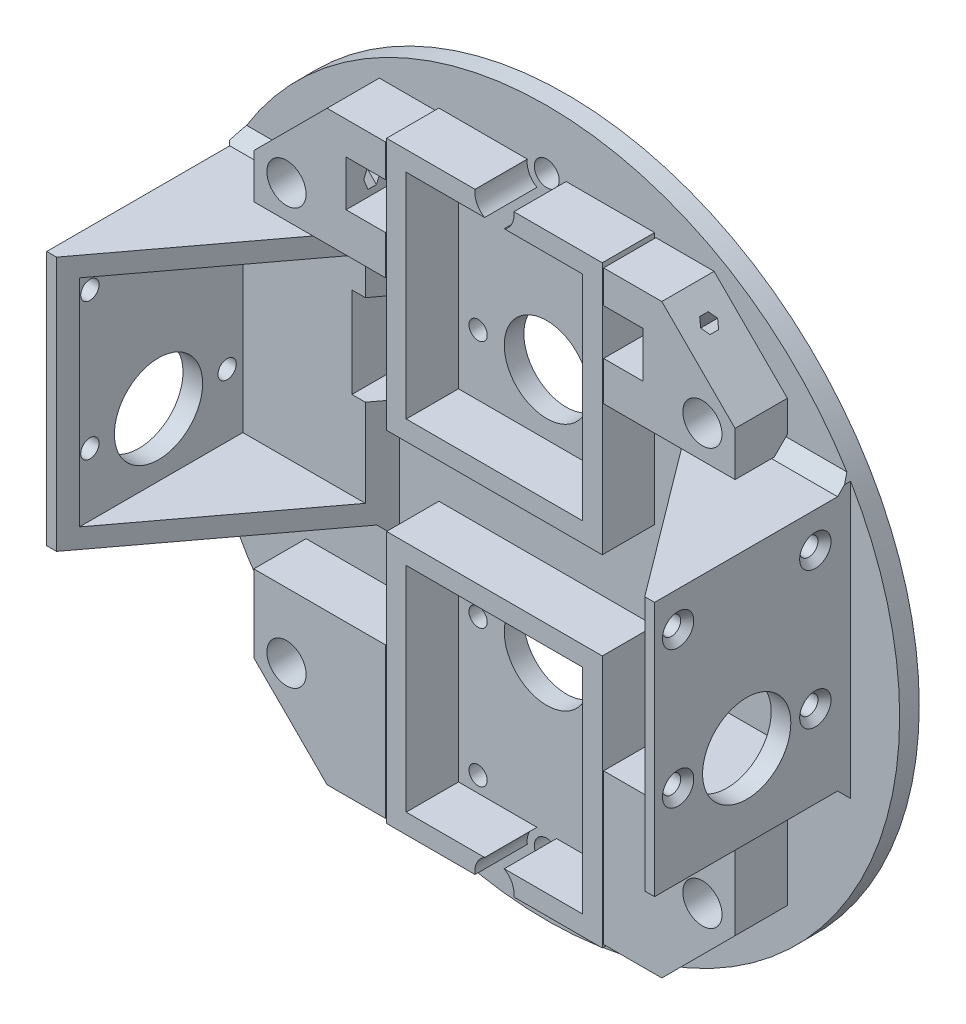
from build123d import *

# Parameters (mm, degrees)
EXTRUDE_START                  = 26.4
EXTRUDE_3_DEPTH                = 39
SHELL_2_T                      = -3
SKETCH_7_R                     = 6.75
SKETCH_7_R_2                   = 1.4
CUT_EXTRUDE_5_DEPTH            = 47.496881616
SKETCH_13_R                    = 2.4
CUT_EXTRUDE_11_DEPTH           = 1.2
CUT_EXTRUDE_11_DRAFT           = -45
CUT_EXTRUDE_11_PROFILE_2_DEPTH = 1.2
CUT_EXTRUDE_11_PROFILE_2_DRAFT = -45
CUT_EXTRUDE_11_PROFILE_3_DEPTH = 1.2
CUT_EXTRUDE_11_PROFILE_3_DRAFT = -45
CUT_EXTRUDE_11_PROFILE_4_DEPTH = 1.2
CUT_EXTRUDE_11_PROFILE_4_DRAFT = -45
SKETCH_1_R                     = 54
EXTRUDE_1_DEPTH                = 3
CUT_EXTRUDE_START              = 30
SKETCH_11_W                    = 6.048047195
SKETCH_11_H                    = 39
CUT_EXTRUDE_9_DEPTH            = 10
SKETCH_9_W                     = 33
SKETCH_9_H                     = 38.7
SKETCH_9_W_2                   = 27
SKETCH_9_H_2                   = 32.7
EXTRUDE_5_DEPTH                = 8
SKETCH_8_R                     = 1.4
SKETCH_8_R_2                   = 6.5
CUT_EXTRUDE_8_DEPTH            = 84.192547743
CUT_EXTRUDE_10_DEPTH           = 83.048765987
CUT_EXTRUDE_10_DEPTH_BACK      = 83.048765987
SKETCH_12_R                    = 1.9
SKETCH_14_R                    = 2.4
CUT_EXTRUDE_12_DEPTH           = 1.2
CUT_EXTRUDE_12_DRAFT           = -45
CUT_EXTRUDE_12_PROFILE_2_DEPTH = 1.2
CUT_EXTRUDE_12_PROFILE_2_DRAFT = -45
CUT_EXTRUDE_12_PROFILE_3_DEPTH = 1.2
CUT_EXTRUDE_12_PROFILE_3_DRAFT = -45
CUT_EXTRUDE_12_PROFILE_4_DEPTH = 1.2
CUT_EXTRUDE_12_PROFILE_4_DRAFT = -45
CHAMFER_1_SIZE                 = 2
CUT_EXTRUDE_13_DEPTH           = 82
CUT_EXTRUDE_13_DEPTH_BACK      = 82
SKETCH_15_W                    = 6.3
SKETCH_15_H                    = 13.85
CUT_EXTRUDE_14_DEPTH           = 83.048765987
CUT_EXTRUDE_14_DEPTH_BACK      = 83.048765987
SKETCH_16_W                    = 5
SKETCH_16_H                    = 10
SKETCH_17_R                    = 3
CUT_EXTRUDE_16_DEPTH           = 8
SKETCH_18_R                    = 1.9
EXTRUDE_6_DEPTH                = 8
CUT_EXTRUDE_17_DEPTH           = 10
SKETCH_25_R                    = 3
CUT_EXTRUDE_21_DEPTH           = 5
SKETCH_20_R                    = 1.9
EXTRUDE_7_DEPTH                = 8
CUT_EXTRUDE_18_DEPTH           = 10
CUT_EXTRUDE_19_DEPTH           = 110.837320652
SKETCH_24_R                    = 3
CUT_EXTRUDE_20_DEPTH           = 5


# Read off the part's stored shape, not the designer's step: ﾐﾗｰ1
with BuildPart() as part:
    # ｽｹｯﾁ5 → ﾎﾞｽ - 押し出し3 (new body)
    with BuildSketch(Plane(origin=(0, 0, 0), x_dir=(1, 0, 0), z_dir=(0, 1, 0)).offset(EXTRUDE_START)):
        Polygon((-46.5, -32), (-46.5, 0), (-22.5, 0), align=None)
    extrude(amount=-EXTRUDE_3_DEPTH)

    # ｼｪﾙ2
    shell_2_openings = [part.faces().sort_by_distance(p)[0] for p in [
        (-34.5, 6.9, 16),
    ]]
    offset(amount=SHELL_2_T, openings=shell_2_openings, kind=Kind.INTERSECTION)

    # ｽｹｯﾁ7 → ｶｯﾄ - 押し出し5 (cut, through all)
    with BuildSketch(Plane(origin=(-43.5, 0, 0), x_dir=(0, 0, -1), z_dir=(1, 0, 0))):
        with Locations((-15.9, 0)):
            Circle(SKETCH_7_R)
        with Locations((-26.4, 0)):
            Circle(SKETCH_7_R_2)
        with Locations((-5.4, 0)):
            Circle(SKETCH_7_R_2)
        with Locations((-5.4, 21)):
            Circle(SKETCH_7_R_2)
        with Locations((-26.4, 21)):
            Circle(SKETCH_7_R_2)
    extrude(amount=-CUT_EXTRUDE_5_DEPTH, mode=Mode.SUBTRACT)


with BuildPart() as cut_extrude_11_tool:
    # ｽｹｯﾁ13 → ｶｯﾄ - 押し出し11 (with draft: the straight prism first)
    with BuildSketch(Plane.ZY.offset(46.5)):
        with Locations((26.4, 21)):
            Circle(SKETCH_13_R)
    extrude(amount=-CUT_EXTRUDE_11_DEPTH)
    # ｶｯﾄ - 押し出し11: the draft: its side faces are tilted about the plane it starts from
    cut_extrude_11_sides = [cut_extrude_11_tool.faces().sort_by_distance(p)[0] for p in [
        (-45.9, 21, 24),
    ]]
    draft(cut_extrude_11_sides, Plane.ZY.offset(46.5), CUT_EXTRUDE_11_DRAFT)


with BuildPart() as part_1:
    add(part.part)

    # ｶｯﾄ - 押し出し11: cut by cut_extrude_11_tool
    add(cut_extrude_11_tool.part, mode=Mode.SUBTRACT)


with BuildPart() as cut_extrude_11_profile_2_tool:
    # ｽｹｯﾁ13 → ｶｯﾄ - 押し出し11 profile 2 (with draft: the straight prism first)
    with BuildSketch(Plane.ZY.offset(46.5)):
        with Locations((5.4, 21)):
            Circle(SKETCH_13_R)
    extrude(amount=-CUT_EXTRUDE_11_PROFILE_2_DEPTH)
    # ｶｯﾄ - 押し出し11 profile 2: the draft: its side faces are tilted about the plane it starts from
    cut_extrude_11_profile_2_sides = [cut_extrude_11_profile_2_tool.faces().sort_by_distance(p)[0] for p in [
        (-45.9, 21, 3),
    ]]
    draft(cut_extrude_11_profile_2_sides, Plane.ZY.offset(46.5), CUT_EXTRUDE_11_PROFILE_2_DRAFT)


with BuildPart() as part_2:
    add(part_1.part)

    # ｶｯﾄ - 押し出し11 profile 2: cut by cut_extrude_11_profile_2_tool
    add(cut_extrude_11_profile_2_tool.part, mode=Mode.SUBTRACT)


with BuildPart() as cut_extrude_11_profile_3_tool:
    # ｽｹｯﾁ13 → ｶｯﾄ - 押し出し11 profile 3 (with draft: the straight prism first)
    with BuildSketch(Plane.ZY.offset(46.5)):
        with Locations((5.4, 0)):
            Circle(SKETCH_13_R)
    extrude(amount=-CUT_EXTRUDE_11_PROFILE_3_DEPTH)
    # ｶｯﾄ - 押し出し11 profile 3: the draft: its side faces are tilted about the plane it starts from
    cut_extrude_11_profile_3_sides = [cut_extrude_11_profile_3_tool.faces().sort_by_distance(p)[0] for p in [
        (-45.9, 0, 3),
    ]]
    draft(cut_extrude_11_profile_3_sides, Plane.ZY.offset(46.5), CUT_EXTRUDE_11_PROFILE_3_DRAFT)


with BuildPart() as part_3:
    add(part_2.part)

    # ｶｯﾄ - 押し出し11 profile 3: cut by cut_extrude_11_profile_3_tool
    add(cut_extrude_11_profile_3_tool.part, mode=Mode.SUBTRACT)


with BuildPart() as cut_extrude_11_profile_4_tool:
    # ｽｹｯﾁ13 → ｶｯﾄ - 押し出し11 profile 4 (with draft: the straight prism first)
    with BuildSketch(Plane.ZY.offset(46.5)):
        with Locations((26.4, 0)):
            Circle(SKETCH_13_R)
    extrude(amount=-CUT_EXTRUDE_11_PROFILE_4_DEPTH)
    # ｶｯﾄ - 押し出し11 profile 4: the draft: its side faces are tilted about the plane it starts from
    cut_extrude_11_profile_4_sides = [cut_extrude_11_profile_4_tool.faces().sort_by_distance(p)[0] for p in [
        (-45.9, 0, 24),
    ]]
    draft(cut_extrude_11_profile_4_sides, Plane.ZY.offset(46.5), CUT_EXTRUDE_11_PROFILE_4_DRAFT)


with BuildPart() as part_4:
    add(part_3.part)

    # ｶｯﾄ - 押し出し11 profile 4: cut by cut_extrude_11_profile_4_tool
    add(cut_extrude_11_profile_4_tool.part, mode=Mode.SUBTRACT)

    # ｽｹｯﾁ1 → ﾎﾞｽ - 押し出し1 (add)
    with BuildSketch(Plane.XY):
        Circle(SKETCH_1_R)
    extrude(amount=-EXTRUDE_1_DEPTH)

    # ｽｹｯﾁ11 → ｶｯﾄ - 押し出し9 (cut)
    with BuildSketch(Plane.XY.offset(CUT_EXTRUDE_START)):
        with Locations((-43.475976403, 6.9)):
            Rectangle(SKETCH_11_W, SKETCH_11_H)
    extrude(amount=CUT_EXTRUDE_9_DEPTH, mode=Mode.SUBTRACT)

    # ﾐﾗｰ1: part across plane


with BuildPart() as part_5:
    add(part_4.part)
    add(part_4.part.mirror(Plane(origin=(0, 0, 0), x_dir=(0, 0, 1), z_dir=(1, 0, 0))))

    # ｽｹｯﾁ9 → ﾎﾞｽ - 押し出し5 (add)
    with BuildSketch(Plane.XY):
        with Locations((0, -26.05)):
            Rectangle(SKETCH_9_W, SKETCH_9_H)
        with Locations((0, -26.05)):
            Rectangle(SKETCH_9_W_2, SKETCH_9_H_2, mode=Mode.SUBTRACT)
    extrude_5 = extrude(amount=EXTRUDE_5_DEPTH)

    # ｽｹｯﾁ8 → ｶｯﾄ - 押し出し8 (cut, symmetric)
    with BuildSketch(Plane(origin=(0, 0, -3), x_dir=(-1, 0, 0), z_dir=(0, 0, -1))):
        with Locations(Location((-10.5, -40, 0), (0, 0, 180))):
            Circle(SKETCH_8_R)
        with Locations(Location((10.5, -40, 0), (0, 0, 180))):
            Circle(SKETCH_8_R)
        with Locations(Location((-10.5, -19, 0), (0, 0, 180))):
            Circle(SKETCH_8_R)
        with Locations(Location((10.5, -19, 0), (0, 0, 180))):
            Circle(SKETCH_8_R)
        with Locations(Location((0, -19, 0), (0, 0, 180))):
            Circle(SKETCH_8_R_2)
    cut_extrude_8 = extrude(amount=CUT_EXTRUDE_8_DEPTH, both=True, mode=Mode.SUBTRACT)

    # ｽｹｯﾁ12 → ｶｯﾄ - 押し出し10 (cut, two sides: drawn at the far end of the back side and taken through both)
    with BuildSketch(Plane.XY.offset(-CUT_EXTRUDE_10_DEPTH_BACK)):
        with Locations((-31.819805153, 31.819805153)):
            Circle(SKETCH_12_R)
        with Locations((31.819805153, 31.819805153)):
            Circle(SKETCH_12_R)
        with Locations((31.819805153, -31.819805153)):
            Circle(SKETCH_12_R)
        with Locations((-31.819805153, -31.819805153)):
            Circle(SKETCH_12_R)
        with Locations((0, -45)):
            Circle(SKETCH_12_R)
        with Locations((0, 45)):
            Circle(SKETCH_12_R)
    extrude(amount=CUT_EXTRUDE_10_DEPTH + CUT_EXTRUDE_10_DEPTH_BACK, mode=Mode.SUBTRACT)


with BuildPart() as cut_extrude_12_tool:
    # ｽｹｯﾁ14 → ｶｯﾄ - 押し出し12 (with draft: the straight prism first)
    with BuildSketch(Plane(origin=(0, 0, -3), x_dir=(-1, 0, 0), z_dir=(0, 0, -1))):
        with Locations((10.5, -19)):
            Circle(SKETCH_14_R)
    extrude(amount=-CUT_EXTRUDE_12_DEPTH)
    # ｶｯﾄ - 押し出し12: the draft: its side faces are tilted about the plane it starts from
    cut_extrude_12_sides = [cut_extrude_12_tool.faces().sort_by_distance(p)[0] for p in [
        (-8.1, -19, -2.4),
    ]]
    draft(cut_extrude_12_sides, Plane(origin=(0, 0, -3), x_dir=(-1, 0, 0), z_dir=(0, 0, -1)), CUT_EXTRUDE_12_DRAFT)


with BuildPart() as part_6:
    add(part_5.part)

    # ｶｯﾄ - 押し出し12: cut by cut_extrude_12_tool
    add(cut_extrude_12_tool.part, mode=Mode.SUBTRACT)


with BuildPart() as cut_extrude_12_profile_2_tool:
    # ｽｹｯﾁ14 → ｶｯﾄ - 押し出し12 profile 2 (with draft: the straight prism first)
    with BuildSketch(Plane(origin=(0, 0, -3), x_dir=(-1, 0, 0), z_dir=(0, 0, -1))):
        with Locations((-10.5, -19)):
            Circle(SKETCH_14_R)
    extrude(amount=-CUT_EXTRUDE_12_PROFILE_2_DEPTH)
    # ｶｯﾄ - 押し出し12 profile 2: the draft: its side faces are tilted about the plane it starts from
    cut_extrude_12_profile_2_sides = [cut_extrude_12_profile_2_tool.faces().sort_by_distance(p)[0] for p in [
        (12.9, -19, -2.4),
    ]]
    draft(cut_extrude_12_profile_2_sides, Plane(origin=(0, 0, -3), x_dir=(-1, 0, 0), z_dir=(0, 0, -1)), CUT_EXTRUDE_12_PROFILE_2_DRAFT)


with BuildPart() as part_7:
    add(part_6.part)

    # ｶｯﾄ - 押し出し12 profile 2: cut by cut_extrude_12_profile_2_tool
    add(cut_extrude_12_profile_2_tool.part, mode=Mode.SUBTRACT)


with BuildPart() as cut_extrude_12_profile_3_tool:
    # ｽｹｯﾁ14 → ｶｯﾄ - 押し出し12 profile 3 (with draft: the straight prism first)
    with BuildSketch(Plane(origin=(0, 0, -3), x_dir=(-1, 0, 0), z_dir=(0, 0, -1))):
        with Locations((10.5, -40)):
            Circle(SKETCH_14_R)
    extrude(amount=-CUT_EXTRUDE_12_PROFILE_3_DEPTH)
    # ｶｯﾄ - 押し出し12 profile 3: the draft: its side faces are tilted about the plane it starts from
    cut_extrude_12_profile_3_sides = [cut_extrude_12_profile_3_tool.faces().sort_by_distance(p)[0] for p in [
        (-8.1, -40, -2.4),
    ]]
    draft(cut_extrude_12_profile_3_sides, Plane(origin=(0, 0, -3), x_dir=(-1, 0, 0), z_dir=(0, 0, -1)), CUT_EXTRUDE_12_PROFILE_3_DRAFT)


with BuildPart() as part_8:
    add(part_7.part)

    # ｶｯﾄ - 押し出し12 profile 3: cut by cut_extrude_12_profile_3_tool
    add(cut_extrude_12_profile_3_tool.part, mode=Mode.SUBTRACT)


with BuildPart() as cut_extrude_12_profile_4_tool:
    # ｽｹｯﾁ14 → ｶｯﾄ - 押し出し12 profile 4 (with draft: the straight prism first)
    with BuildSketch(Plane(origin=(0, 0, -3), x_dir=(-1, 0, 0), z_dir=(0, 0, -1))):
        with Locations((-10.5, -40)):
            Circle(SKETCH_14_R)
    extrude(amount=-CUT_EXTRUDE_12_PROFILE_4_DEPTH)
    # ｶｯﾄ - 押し出し12 profile 4: the draft: its side faces are tilted about the plane it starts from
    cut_extrude_12_profile_4_sides = [cut_extrude_12_profile_4_tool.faces().sort_by_distance(p)[0] for p in [
        (12.9, -40, -2.4),
    ]]
    draft(cut_extrude_12_profile_4_sides, Plane(origin=(0, 0, -3), x_dir=(-1, 0, 0), z_dir=(0, 0, -1)), CUT_EXTRUDE_12_PROFILE_4_DRAFT)


with BuildPart() as part_9:
    add(part_8.part)

    # ｶｯﾄ - 押し出し12 profile 4: cut by cut_extrude_12_profile_4_tool
    add(cut_extrude_12_profile_4_tool.part, mode=Mode.SUBTRACT)

    # 面取り1
    # the kernel refuses this chamfer: 2 mm, written as the material it adds along each edge
    with BuildSketch(Plane(origin=(46.5, 26.4, 0), x_dir=(0, 0.9996219169112968, -0.02749587661058639), z_dir=(-1, 0, 0))) as chamfer_1_piece_1_section:
        Polygon((CHAMFER_1_SIZE * 0.999621916911, -CHAMFER_1_SIZE * 0.0274958766106), (-CHAMFER_1_SIZE * 0.0274958766106, -CHAMFER_1_SIZE * 0.999621916911), (0, 0), align=None)
    chamfer_1_piece_1 = extrude(amount=29.143365976, mode=Mode.PRIVATE)
    chamfer_1_piece_1 = chamfer_1_piece_1 & Plane(origin=(0, 0, 0.652443575), x_dir=(1, 0, 0), z_dir=(0, 0, 1)) * Cylinder(54, 67, mode=Mode.PRIVATE)
    chamfer_1_piece_1 = split(chamfer_1_piece_1, bisect_by=Plane(origin=(27.212601047, 27.062061668, 6.283468063), z_dir=(0.8, 0, -0.6)), keep=Keep.TOP, mode=Mode.PRIVATE)
    add(chamfer_1_piece_1)
    with BuildSketch(Plane(origin=(46.5, -12.6, 0), x_dir=(0, -0.9996219169112968, -0.027495876610586365), z_dir=(-1, 0, 0))) as chamfer_1_piece_2_section:
        Polygon((CHAMFER_1_SIZE * 0.999621916911, CHAMFER_1_SIZE * 0.0274958766106), (-CHAMFER_1_SIZE * 0.0274958766106, CHAMFER_1_SIZE * 0.999621916911), (0, 0), align=None)
    chamfer_1_piece_2 = extrude(amount=29.143365976, mode=Mode.PRIVATE)
    chamfer_1_piece_2 = split(chamfer_1_piece_2, bisect_by=Plane(origin=(27.220661662, -13.263920155, 6.294215549), z_dir=(0.8, 0, -0.6)), keep=Keep.TOP, mode=Mode.PRIVATE)
    add(chamfer_1_piece_2)
    with BuildSketch(Plane(origin=(-46.5, 26.4, 0), x_dir=(0, 0.9996219169112968, -0.02749587661058639), z_dir=(1, 0, 0))) as chamfer_1_piece_3_section:
        Polygon((CHAMFER_1_SIZE * 0.999621916911, CHAMFER_1_SIZE * 0.0274958766106), (-CHAMFER_1_SIZE * 0.0274958766106, CHAMFER_1_SIZE * 0.999621916911), (0, 0), align=None)
    chamfer_1_piece_3 = extrude(amount=29.143365976, mode=Mode.PRIVATE)
    chamfer_1_piece_3 = chamfer_1_piece_3 & Plane(origin=(0, 0, 0.652443575), x_dir=(1, 0, 0), z_dir=(0, 0, 1)) * Cylinder(54, 67, mode=Mode.PRIVATE)
    chamfer_1_piece_3 = split(chamfer_1_piece_3, bisect_by=Plane(origin=(-27.212601047, 27.062061668, 6.283468063), z_dir=(-0.8, 0, -0.6)), keep=Keep.TOP, mode=Mode.PRIVATE)
    add(chamfer_1_piece_3)
    with BuildSketch(Plane(origin=(-46.5, 26.4, 0), x_dir=(-0.9996219169112968, 0, -0.02749587661058639), z_dir=(0, -1, 0))) as chamfer_1_piece_4_section:
        Polygon((CHAMFER_1_SIZE * 0.999621916911, -CHAMFER_1_SIZE * 0.0274958766106), (-CHAMFER_1_SIZE * 0.0274958766106, -CHAMFER_1_SIZE * 0.999621916911), (0, 0), align=None)
    chamfer_1_piece_4 = extrude(amount=39, mode=Mode.PRIVATE)
    chamfer_1_piece_4 = chamfer_1_piece_4 & Plane(origin=(0, 0, 0.66368793), x_dir=(1, 0, 0), z_dir=(0, 0, 1)) * Cylinder(54, 86, mode=Mode.PRIVATE)
    add(chamfer_1_piece_4)
    with BuildSketch(Plane(origin=(-46.5, -12.6, 0), x_dir=(0, -0.9996219169112968, -0.027495876610586365), z_dir=(1, 0, 0))) as chamfer_1_piece_5_section:
        Polygon((CHAMFER_1_SIZE * 0.999621916911, -CHAMFER_1_SIZE * 0.0274958766106), (-CHAMFER_1_SIZE * 0.0274958766106, -CHAMFER_1_SIZE * 0.999621916911), (0, 0), align=None)
    chamfer_1_piece_5 = extrude(amount=29.143365976, mode=Mode.PRIVATE)
    chamfer_1_piece_5 = split(chamfer_1_piece_5, bisect_by=Plane(origin=(-27.220661662, -13.263920155, 6.294215549), z_dir=(-0.8, 0, -0.6)), keep=Keep.TOP, mode=Mode.PRIVATE)
    add(chamfer_1_piece_5)
    with BuildSketch(Plane(origin=(-46.5, 31.543365976, 0), x_dir=(-0.9996219169112968, 0, -0.02749587661058639), z_dir=(0, -1, 0))) as chamfer_1_piece_6a_section:
        Polygon((CHAMFER_1_SIZE * 0.999621916911, -CHAMFER_1_SIZE * 0.0274958766106), (-CHAMFER_1_SIZE * 0.0274958766106, -CHAMFER_1_SIZE * 0.999621916911), (0, 0), align=None)
    chamfer_1_piece_6a = extrude(amount=44.143365976, mode=Mode.PRIVATE)
    chamfer_1_piece_6a = chamfer_1_piece_6a & Plane(origin=(0, 0, 0.937375556), x_dir=(1, 0, 0), z_dir=(0, 0, 1)) * Cylinder(54, 97, mode=Mode.PRIVATE)
    chamfer_1_piece_6a = split(chamfer_1_piece_6a, bisect_by=Plane(origin=(-46.656865696, 26.4, 0.937375556), z_dir=(0, 1, 0)), keep=Keep.TOP, mode=Mode.PRIVATE)
    with BuildSketch(Plane(origin=(-51.643365976, 26.4, 0), x_dir=(0, 0.9996219169112968, -0.02749587661058639), z_dir=(1, 0, 0))) as chamfer_1_piece_6b_section:
        Polygon((CHAMFER_1_SIZE * 0.999621916911, CHAMFER_1_SIZE * 0.0274958766106), (-CHAMFER_1_SIZE * 0.0274958766106, CHAMFER_1_SIZE * 0.999621916911), (0, 0), align=None)
    chamfer_1_piece_6b = extrude(amount=34.286731952, mode=Mode.PRIVATE)
    chamfer_1_piece_6b = chamfer_1_piece_6b & Plane(origin=(0, 0, 0.863935578), x_dir=(1, 0, 0), z_dir=(0, 0, 1)) * Cylinder(54, 77, mode=Mode.PRIVATE)
    chamfer_1_piece_6b = split(chamfer_1_piece_6b, bisect_by=Plane(origin=(-46.5, 26.680281606, 0.863935578), z_dir=(-1, 0, 0)), keep=Keep.TOP, mode=Mode.PRIVATE)
    chamfer_1_piece_6 = chamfer_1_piece_6a & chamfer_1_piece_6b
    add(chamfer_1_piece_6)
    with BuildSketch(Plane(origin=(-46.5, 26.4, 0), x_dir=(-0.9996219169112968, 0, -0.02749587661058639), z_dir=(0, -1, 0))) as chamfer_1_piece_7a_section:
        Polygon((CHAMFER_1_SIZE * 0.999621916911, -CHAMFER_1_SIZE * 0.0274958766106), (-CHAMFER_1_SIZE * 0.0274958766106, -CHAMFER_1_SIZE * 0.999621916911), (0, 0), align=None)
    chamfer_1_piece_7a = extrude(amount=44.143365976, mode=Mode.PRIVATE)
    chamfer_1_piece_7a = split(chamfer_1_piece_7a, bisect_by=Plane(origin=(-47.159587254, -12.6, 0.659587254), z_dir=(0, -1, 0)), keep=Keep.TOP, mode=Mode.PRIVATE)
    with BuildSketch(Plane(origin=(-51.643365976, -12.6, 0), x_dir=(0, -0.9996219169112968, -0.027495876610586365), z_dir=(1, 0, 0))) as chamfer_1_piece_7b_section:
        Polygon((CHAMFER_1_SIZE * 0.999621916911, -CHAMFER_1_SIZE * 0.0274958766106), (-CHAMFER_1_SIZE * 0.0274958766106, -CHAMFER_1_SIZE * 0.999621916911), (0, 0), align=None)
    chamfer_1_piece_7b = extrude(amount=34.286731952, mode=Mode.PRIVATE)
    chamfer_1_piece_7b = split(chamfer_1_piece_7b, bisect_by=Plane(origin=(-46.5, -13.259587254, 0.659587254), z_dir=(-1, 0, 0)), keep=Keep.TOP, mode=Mode.PRIVATE)
    chamfer_1_piece_7 = chamfer_1_piece_7a & chamfer_1_piece_7b
    add(chamfer_1_piece_7)

    # ｽｹｯﾁ15 → ｶｯﾄ - 押し出し13 (cut, two sides: drawn at the far end of the back side and taken through both)
    with BuildSketch(Plane.XY.offset(3).offset(-CUT_EXTRUDE_13_DEPTH_BACK)):
        with Locations((-23.65, 10.725)):
            Rectangle(SKETCH_15_W, SKETCH_15_H)
    extrude(amount=CUT_EXTRUDE_13_DEPTH + CUT_EXTRUDE_13_DEPTH_BACK, mode=Mode.SUBTRACT)

    # ｽｹｯﾁ16 → ｶｯﾄ - 押し出し14 (cut, two sides: drawn at the far end of the back side and taken through both)
    with BuildSketch(Plane.XY.offset(-CUT_EXTRUDE_14_DEPTH_BACK)):
        with Locations((-23, -31)):
            Rectangle(SKETCH_16_W, SKETCH_16_H)
    extrude(amount=CUT_EXTRUDE_14_DEPTH + CUT_EXTRUDE_14_DEPTH_BACK, mode=Mode.SUBTRACT)

    # ﾐﾗｰ2: ﾎﾞｽ - 押し出し5, ｶｯﾄ - 押し出し8 across plane
    add(extrude_5.mirror(Plane.ZX))
    add(cut_extrude_8.mirror(Plane.ZX), mode=Mode.SUBTRACT)

    # ｽｹｯﾁ17 → ｶｯﾄ - 押し出し16 (cut)
    with BuildSketch(Plane.XY.offset(8)):
        with Locations((0, -45)):
            Circle(SKETCH_17_R)
        with Locations((0, 45)):
            Circle(SKETCH_17_R)
    extrude(amount=-CUT_EXTRUDE_16_DEPTH, mode=Mode.SUBTRACT)


with BuildPart() as body_2:
    # ｽｹｯﾁ18 → ﾎﾞｽ - 押し出し6 (new body)
    with BuildSketch(Plane.XY):
        Polygon((16.7, -44.819805153), (16.7, -21.819805153), (36.819805153, -21.819805153), (36.819805153, -33.608030253), (25.608030253, -44.819805153), align=None)
        with Locations((31.819805153, -31.819805153)):
            Circle(SKETCH_18_R, mode=Mode.SUBTRACT)
    extrude(amount=EXTRUDE_6_DEPTH)

    # ｽｹｯﾁ19 → ｶｯﾄ - 押し出し17 (cut)
    with BuildSketch(Plane(origin=(35.213917703, -35.213917703, 0), x_dir=(0, 0, -1), z_dir=(0.7071067811865477, -0.7071067811865475, 0))):
        Polygon((-5.3, -9), (-4.65, -10.125833025), (-3.35, -10.125833025), (-2.7, -9), (-3.35, -7.874166975), (-4.65, -7.874166975), align=None)
    extrude(amount=-CUT_EXTRUDE_17_DEPTH, mode=Mode.SUBTRACT)

    # ｽｹｯﾁ25 → ｶｯﾄ - 押し出し21 (cut)
    with BuildSketch(Plane.XY.offset(8)):
        with Locations((31.819805153, -31.819805153)):
            Circle(SKETCH_25_R)
    extrude(amount=-CUT_EXTRUDE_21_DEPTH, mode=Mode.SUBTRACT)


with BuildPart() as body_3:
    # ﾐﾗｰ3: mirrored copy
    add(body_2.part.mirror(Plane(origin=(0, 0, 0), x_dir=(0, 0, 1), z_dir=(1, 0, 0))))


with BuildPart() as body_4:
    # ｽｹｯﾁ20 → ﾎﾞｽ - 押し出し7 (new body)
    with BuildSketch(Plane.XY):
        Polygon((-36.819805153, 26.819805153), (-16.7, 26.819805153), (-16.7, 32.819805153), (-22.7, 32.819805153), (-22.7, 39.819805153), (-16.7, 39.819805153), (-16.7, 44.819805153), (-25.608030253, 44.819805153), (-36.819805153, 33.608030253), align=None)
        with Locations((-31.819805153, 31.819805153)):
            Circle(SKETCH_20_R, mode=Mode.SUBTRACT)
    extrude(amount=EXTRUDE_7_DEPTH)

    # ｽｹｯﾁ21 → ｶｯﾄ - 押し出し18 (cut)
    with BuildSketch(Plane(origin=(-35.213917703, 35.213917703, 0), x_dir=(0, 0, 1), z_dir=(-0.7071067811865479, 0.7071067811865472, 0))):
        Polygon((5.3, 9), (4.65, 10.125833025), (3.35, 10.125833025), (2.7, 9), (3.35, 7.874166975), (4.65, 7.874166975), align=None)
    extrude(amount=-CUT_EXTRUDE_18_DEPTH, mode=Mode.SUBTRACT)

    # ｽｹｯﾁ22 → ｶｯﾄ - 押し出し19 (cut, through all)
    with BuildSketch(Plane.ZY.offset(36.819805153)):
        Polygon((0, 26.819805153), (2, 26.819805153), (0, 28.819805153), align=None)
    extrude(amount=-CUT_EXTRUDE_19_DEPTH, mode=Mode.SUBTRACT)

    # ｽｹｯﾁ24 → ｶｯﾄ - 押し出し20 (cut)
    with BuildSketch(Plane.XY.offset(8)):
        with Locations((-31.819805153, 31.819805153)):
            Circle(SKETCH_24_R)
    extrude(amount=-CUT_EXTRUDE_20_DEPTH, mode=Mode.SUBTRACT)


with BuildPart() as body_5:
    # ﾐﾗｰ4: mirrored copy
    add(body_4.part.mirror(Plane(origin=(0, 0, 0), x_dir=(0, 0, 1), z_dir=(1, 0, 0))))


solid = Compound([part_9.part, body_2.part, body_3.part, body_4.part, body_5.part])
